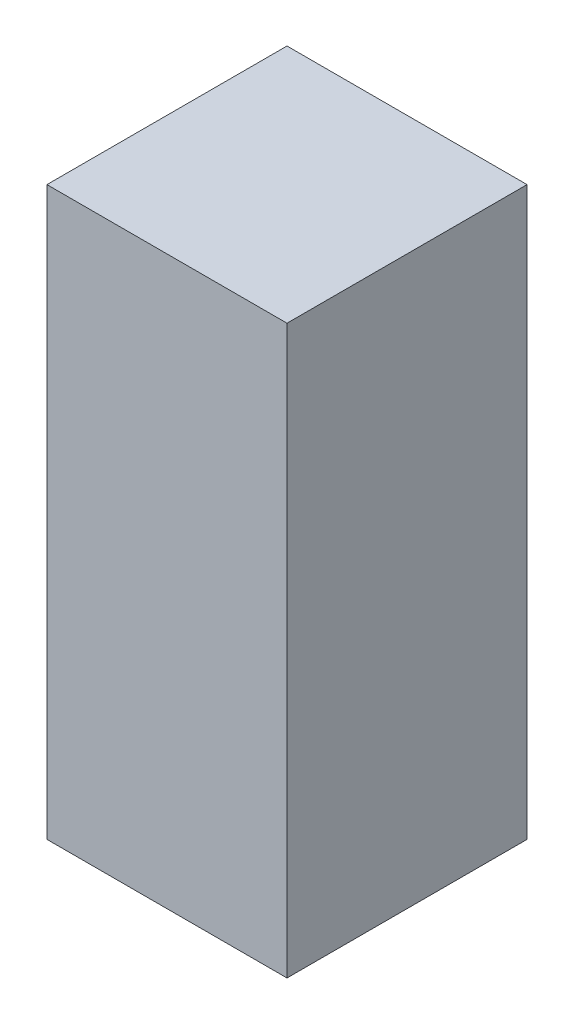
from build123d import *

# Parameters (mm, degrees)
BOSS_EXTRUDE1_DEPTH      = 200
BOSS_EXTRUDE1_DEPTH_BACK = 1600
SKETCH1_W                = 762
SKETCH1_H                = 762
CAVITY1_START            = -1500
CAVITY1_OUTLINE_R        = 304.8
CAVITY1_DEPTH            = 1600


# Read off the part's stored shape, not the designer's step: Cavity1
with BuildPart() as part:
    # Sketch1 → Boss-Extrude1 (new, two sides: drawn at the far end of the back side and taken through both)
    with BuildSketch(Plane(origin=(0, 0, 0), x_dir=(1, 0, 0), z_dir=(0, 1, 0)).offset(-BOSS_EXTRUDE1_DEPTH_BACK)):
        Rectangle(SKETCH1_W, SKETCH1_H)
    extrude(amount=BOSS_EXTRUDE1_DEPTH + BOSS_EXTRUDE1_DEPTH_BACK)

    # Cavity1 outline → Cavity1 (cut)
    with BuildSketch(Plane(origin=(0, 0, 0), x_dir=(1, 0, 0), z_dir=(0, 1, 0)).offset(CAVITY1_START)):
        Circle(CAVITY1_OUTLINE_R)
    extrude(amount=CAVITY1_DEPTH, mode=Mode.SUBTRACT)


solid = part.part
